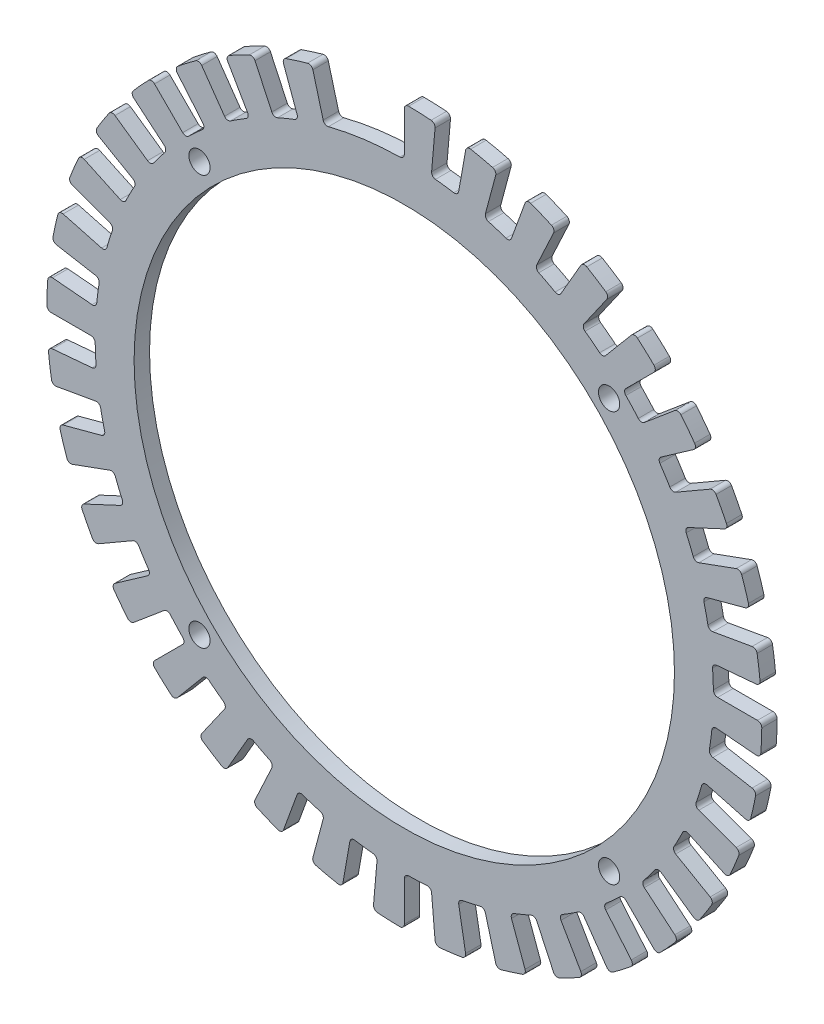
from build123d import *

# Parameters (mm, degrees)
SKETCH1_R           = 62.5
SKETCH1_R_2         = 2.4585
BOSS_EXTRUDE1_DEPTH = 3.571875


with BuildPart() as part:
    # Sketch1 → Boss-Extrude1 (new body)
    with BuildSketch(Plane.XY):
        with BuildLine():
            Line((7.120090774, 81.383009943), (6.318190247, 72.217244977))
            ThreePointArc((6.318190247, 72.217244977), (6.543925597, 71.492600102), (7.213496876, 71.135191451))
            ThreePointArc((7.213496876, 71.135191451), (9.332622744, 70.888307588), (11.443439394, 70.578308954))
            ThreePointArc((11.443439394, 70.578308954), (12.182699751, 70.750241401), (12.58829525, 71.391769993))
            Line((12.58829525, 71.391769993), (14.185993357, 80.45276622))
            ThreePointArc((14.185993357, 80.45276622), (14.60224868, 81.101765071), (15.35649023, 81.261726586))
            ThreePointArc((15.35649023, 81.261726586), (17.899556073, 80.739679789), (20.424982959, 80.138068801))
            ThreePointArc((20.424982959, 80.138068801), (21.040955292, 79.674338181), (21.143931966, 78.910228368))
            Line((21.143931966, 78.910228368), (18.762595726, 70.022960532))
            ThreePointArc((18.762595726, 70.022960532), (18.859068387, 69.270126109), (19.456404014, 68.801877466))
            ThreePointArc((19.456404014, 68.801877466), (21.500464665, 68.190761978), (23.525382569, 67.518933456))
            ThreePointArc((23.525382569, 67.518933456), (24.283267656, 67.559882649), (24.794101519, 68.12123406))
            Line((24.794101519, 68.12123406), (27.940952485, 76.76713603))
            ThreePointArc((27.940952485, 76.76713603), (28.463581422, 77.333993152), (29.234141374, 77.360551822))
            ThreePointArc((29.234141374, 77.360551822), (31.647919857, 76.404837339), (34.030511182, 75.373830397))
            ThreePointArc((34.030511182, 75.373830397), (34.556599534, 74.810182414), (34.525325484, 74.039799434))
            Line((34.525325484, 74.039799434), (30.636909229, 65.701063864))
            ThreePointArc((30.636909229, 65.701063864), (30.601187928, 64.942914386), (31.108138161, 64.378053249))
            ThreePointArc((31.108138161, 64.378053249), (33.015025846, 63.421274572), (34.892518899, 62.40802933))
            ThreePointArc((34.892518899, 62.40802933), (35.646000762, 62.316751049), (36.24655156, 62.780868901))
            Line((36.24655156, 62.780868901), (40.84693991, 70.748975258))
            ThreePointArc((40.84693991, 70.748975258), (41.460062645, 71.216466984), (42.223527925, 71.108815836))
            ThreePointArc((42.223527925, 71.108815836), (44.43467761, 69.748472569), (46.602039543, 68.319396297))
            ThreePointArc((46.602039543, 68.319396297), (47.022258986, 67.67295711), (46.857684459, 66.91970866))
            Line((46.857684459, 66.91970866), (41.580335748, 59.382873618))
            ThreePointArc((41.580335748, 59.382873618), (41.413505858, 58.642445073), (41.814667271, 57.998134462))
            ThreePointArc((41.814667271, 57.998134462), (43.526442174, 56.724763831), (45.199463699, 55.400888814))
            ThreePointArc((45.199463699, 55.400888814), (45.925648172, 55.180156502), (46.597668473, 55.53293881))
            Line((46.597668473, 55.53293881), (52.511813735, 62.581142673))
            ThreePointArc((52.511813735, 62.581142673), (53.196800845, 62.935064503), (53.929973946, 62.696474464))
            ThreePointArc((53.929973946, 62.696474464), (55.87131017, 60.972835754), (57.757588515, 59.189111912))
            ThreePointArc((57.757588515, 59.189111912), (58.059170893, 58.479523249), (57.766296402, 57.766296402))
            Line((57.766296402, 57.766296402), (51.260364806, 51.260364806))
            ThreePointArc((51.260364806, 51.260364806), (50.967495369, 50.56015474), (51.250678875, 49.855971707))
            ThreePointArc((51.250678875, 49.855971707), (52.715329582, 48.304699845), (54.133045666, 46.710420325))
            ThreePointArc((54.133045666, 46.710420325), (54.809868002, 46.366940822), (55.53293881, 46.597668473))
            Line((55.53293881, 46.597668473), (62.581142673, 52.511813735))
            ThreePointArc((62.581142673, 52.511813735), (63.31718117, 52.741411935), (63.997784998, 52.379132441))
            ThreePointArc((63.997784998, 52.379132441), (65.610321242, 50.344570179), (67.158202386, 48.260396313))
            ThreePointArc((67.158202386, 48.260396313), (67.331984272, 47.509218665), (66.91970866, 46.857684459))
            Line((66.91970866, 46.857684459), (59.382873618, 41.580335748))
            ThreePointArc((59.382873618, 41.580335748), (58.972863325, 40.94161969), (59.129464536, 40.19896048))
            ThreePointArc((59.129464536, 40.19896048), (60.302488376, 38.416921997), (61.421822434, 36.600679351))
            ThreePointArc((61.421822434, 36.600679351), (62.028717727, 36.144889108), (62.780868901, 36.24655156))
            Line((62.780868901, 36.24655156), (70.748975258, 40.84693991))
            ThreePointArc((70.748975258, 40.84693991), (71.513700985, 40.945238253), (72.121055738, 40.470276985))
            ThreePointArc((72.121055738, 40.470276985), (73.355795904, 38.186610315), (74.518248261, 35.865312993))
            ThreePointArc((74.518248261, 35.865312993), (74.55894938, 35.095370514), (74.039799434, 34.525325484))
            Line((74.039799434, 34.525325484), (65.701063864, 30.636909229))
            ThreePointArc((65.701063864, 30.636909229), (65.186370669, 30.079094244), (65.211631338, 29.320524181))
            ThreePointArc((65.211631338, 29.320524181), (66.057386575, 27.361865414), (66.844328207, 25.378845255))
            ThreePointArc((66.844328207, 25.378845255), (67.362856253, 24.824593229), (68.12123406, 24.794101519))
            Line((68.12123406, 24.794101519), (76.76713603, 27.940952485))
            ThreePointArc((76.76713603, 27.940952485), (77.537313183, 27.904964226), (78.052964694, 27.331752641))
            ThreePointArc((78.052964694, 27.331752641), (78.872391827, 24.868369619), (79.614094871, 22.380480286))
            ThreePointArc((79.614094871, 22.380480286), (79.52047854, 21.615167288), (78.910228368, 21.143931966))
            Line((78.910228368, 21.143931966), (70.022960532, 18.762595726))
            ThreePointArc((70.022960532, 18.762595726), (69.419223127, 18.30263074), (69.312375721, 17.551198591))
            ThreePointArc((69.312375721, 17.551198591), (69.805164509, 15.475432397), (70.235802893, 13.385887789))
            ThreePointArc((70.235802893, 13.385887789), (70.650208479, 12.750014647), (71.391769993, 12.58829525))
            Line((71.391769993, 12.58829525), (80.45276622, 14.185993357))
            ThreePointArc((80.45276622, 14.185993357), (81.204993357, 14.016811982), (81.613273815, 13.362766823))
            ThreePointArc((81.613273815, 13.362766823), (81.992490036, 10.794516097), (82.290907495, 8.215628011))
            ThreePointArc((82.290907495, 8.215628011), (82.065818199, 7.478198142), (81.383009943, 7.120090774))
            Line((81.383009943, 7.120090774), (72.217244977, 6.318190247))
            ThreePointArc((72.217244977, 6.318190247), (71.542807618, 5.970051062), (71.30709864, 5.248588713))
            ThreePointArc((71.30709864, 5.248588713), (71.431947843, 3.118786197), (71.49319825, 0.986206897))
            ThreePointArc((71.49319825, 0.986206897), (71.79088987, 0.288033321), (72.49310312, 0))
            Line((72.49310312, 0), (81.69387982, 0))
            ThreePointArc((81.69387982, 0), (82.405300898, -0.297234001), (82.693804909, -1.012239902))
            ThreePointArc((82.693804909, -1.012239902), (82.621287925, -3.607323335), (82.467352536, -6.198851964))
            ThreePointArc((82.467352536, -6.198851964), (82.1176295, -6.88599227), (81.383009943, -7.120090774))
            Line((81.383009943, -7.120090774), (72.217244977, -6.318190247))
            ThreePointArc((72.217244977, -6.318190247), (71.492600102, -6.543925597), (71.135191451, -7.213496876))
            ThreePointArc((71.135191451, -7.213496876), (70.888307588, -9.332622744), (70.578308954, -11.443439394))
            ThreePointArc((70.578308954, -11.443439394), (70.750241401, -12.182699751), (71.391769993, -12.58829525))
            Line((71.391769993, -12.58829525), (80.45276622, -14.185993357))
            ThreePointArc((80.45276622, -14.185993357), (81.101765071, -14.60224868), (81.261726586, -15.35649023))
            ThreePointArc((81.261726586, -15.35649023), (80.739679789, -17.899556073), (80.138068801, -20.424982959))
            ThreePointArc((80.138068801, -20.424982959), (79.674338181, -21.040955292), (78.910228368, -21.143931966))
            Line((78.910228368, -21.143931966), (70.022960532, -18.762595726))
            ThreePointArc((70.022960532, -18.762595726), (69.270126109, -18.859068387), (68.801877466, -19.456404014))
            ThreePointArc((68.801877466, -19.456404014), (68.190761979, -21.500464665), (67.518933456, -23.525382569))
            ThreePointArc((67.518933456, -23.525382569), (67.559882649, -24.283267656), (68.12123406, -24.794101519))
            Line((68.12123406, -24.794101519), (76.76713603, -27.940952485))
            ThreePointArc((76.76713603, -27.940952485), (77.333993152, -28.463581422), (77.360551822, -29.234141374))
            ThreePointArc((77.360551822, -29.234141374), (76.404837339, -31.647919857), (75.373830397, -34.030511182))
            ThreePointArc((75.373830397, -34.030511182), (74.810182414, -34.556599534), (74.039799434, -34.525325484))
            Line((74.039799434, -34.525325484), (65.701063864, -30.636909229))
            ThreePointArc((65.701063864, -30.636909229), (64.942914386, -30.601187928), (64.378053249, -31.10813816))
            ThreePointArc((64.378053249, -31.10813816), (63.421274572, -33.015025846), (62.40802933, -34.892518899))
            ThreePointArc((62.40802933, -34.892518899), (62.316751049, -35.646000762), (62.780868901, -36.24655156))
            Line((62.780868901, -36.24655156), (70.748975258, -40.84693991))
            ThreePointArc((70.748975258, -40.84693991), (71.216466984, -41.460062645), (71.108815836, -42.223527925))
            ThreePointArc((71.108815836, -42.223527925), (69.748472569, -44.43467761), (68.319396297, -46.602039543))
            ThreePointArc((68.319396297, -46.602039543), (67.67295711, -47.022258986), (66.91970866, -46.857684459))
            Line((66.91970866, -46.857684459), (59.382873618, -41.580335748))
            ThreePointArc((59.382873618, -41.580335748), (58.642445073, -41.413505858), (57.998134462, -41.814667271))
            ThreePointArc((57.998134462, -41.814667271), (56.724763831, -43.526442174), (55.400888814, -45.199463699))
            ThreePointArc((55.400888814, -45.199463699), (55.180156502, -45.925648172), (55.53293881, -46.597668473))
            Line((55.53293881, -46.597668473), (62.581142673, -52.511813735))
            ThreePointArc((62.581142673, -52.511813735), (62.935064503, -53.196800845), (62.696474464, -53.929973946))
            ThreePointArc((62.696474464, -53.929973946), (60.972835754, -55.87131017), (59.189111912, -57.757588515))
            ThreePointArc((59.189111912, -57.757588515), (58.479523249, -58.059170893), (57.766296402, -57.766296402))
            Line((57.766296402, -57.766296402), (51.260364806, -51.260364806))
            ThreePointArc((51.260364806, -51.260364806), (50.56015474, -50.967495369), (49.855971707, -51.250678875))
            ThreePointArc((49.855971707, -51.250678875), (48.304699845, -52.715329582), (46.710420325, -54.133045666))
            ThreePointArc((46.710420325, -54.133045666), (46.366940822, -54.809868002), (46.597668473, -55.53293881))
            Line((46.597668473, -55.53293881), (52.511813735, -62.581142673))
            ThreePointArc((52.511813735, -62.581142673), (52.741411935, -63.31718117), (52.379132441, -63.997784998))
            ThreePointArc((52.379132441, -63.997784998), (50.344570179, -65.610321242), (48.260396313, -67.158202386))
            ThreePointArc((48.260396313, -67.158202386), (47.509218665, -67.331984272), (46.857684459, -66.91970866))
            Line((46.857684459, -66.91970866), (41.580335748, -59.382873618))
            ThreePointArc((41.580335748, -59.382873618), (40.94161969, -58.972863325), (40.19896048, -59.129464536))
            ThreePointArc((40.19896048, -59.129464536), (38.416921997, -60.302488376), (36.600679351, -61.421822434))
            ThreePointArc((36.600679351, -61.421822434), (36.144889108, -62.028717727), (36.24655156, -62.780868901))
            Line((36.24655156, -62.780868901), (40.84693991, -70.748975258))
            ThreePointArc((40.84693991, -70.748975258), (40.945238253, -71.513700985), (40.470276985, -72.121055738))
            ThreePointArc((40.470276985, -72.121055738), (38.186610315, -73.355795904), (35.865312993, -74.518248261))
            ThreePointArc((35.865312993, -74.518248261), (35.095370514, -74.55894938), (34.525325484, -74.039799434))
            Line((34.525325484, -74.039799434), (30.636909229, -65.701063864))
            ThreePointArc((30.636909229, -65.701063864), (30.079094244, -65.186370669), (29.320524181, -65.211631338))
            ThreePointArc((29.320524181, -65.211631338), (27.361865414, -66.057386575), (25.378845255, -66.844328207))
            ThreePointArc((25.378845255, -66.844328207), (24.824593229, -67.362856253), (24.794101519, -68.12123406))
            Line((24.794101519, -68.12123406), (27.940952485, -76.76713603))
            ThreePointArc((27.940952485, -76.76713603), (27.904964226, -77.537313183), (27.331752641, -78.052964694))
            ThreePointArc((27.331752641, -78.052964694), (24.868369619, -78.872391827), (22.380480286, -79.614094871))
            ThreePointArc((22.380480286, -79.614094871), (21.615167288, -79.52047854), (21.143931966, -78.910228368))
            Line((21.143931966, -78.910228368), (18.762595726, -70.022960532))
            ThreePointArc((18.762595726, -70.022960532), (18.30263074, -69.419223127), (17.551198591, -69.312375721))
            ThreePointArc((17.551198591, -69.312375721), (15.475432397, -69.805164509), (13.385887789, -70.235802893))
            ThreePointArc((13.385887789, -70.235802893), (12.750014647, -70.650208479), (12.58829525, -71.391769993))
            Line((12.58829525, -71.391769993), (14.185993357, -80.45276622))
            ThreePointArc((14.185993357, -80.45276622), (14.016811982, -81.204993357), (13.362766823, -81.613273815))
            ThreePointArc((13.362766823, -81.613273815), (10.794516097, -81.992490036), (8.215628011, -82.290907495))
            ThreePointArc((8.215628011, -82.290907495), (7.478198142, -82.065818199), (7.120090774, -81.383009943))
            Line((7.120090774, -81.383009943), (6.318190247, -72.217244977))
            ThreePointArc((6.318190247, -72.217244977), (5.970051062, -71.542807618), (5.248588713, -71.30709864))
            ThreePointArc((5.248588713, -71.30709864), (3.118786197, -71.431947843), (0.986206897, -71.49319825))
            ThreePointArc((0.986206897, -71.49319825), (0.288033321, -71.79088987), (0, -72.49310312))
            Line((0, -72.49310312), (0, -81.69387982))
            ThreePointArc((0, -81.69387982), (-0.297234001, -82.405300898), (-1.012239902, -82.693804909))
            ThreePointArc((-1.012239902, -82.693804909), (-3.607323335, -82.621287925), (-6.198851964, -82.467352536))
            ThreePointArc((-6.198851964, -82.467352536), (-6.88599227, -82.1176295), (-7.120090774, -81.383009943))
            Line((-7.120090774, -81.383009943), (-6.318190247, -72.217244977))
            ThreePointArc((-6.318190247, -72.217244977), (-6.543925597, -71.492600102), (-7.213496876, -71.135191451))
            ThreePointArc((-7.213496876, -71.135191451), (-9.332622744, -70.888307588), (-11.443439394, -70.578308954))
            ThreePointArc((-11.443439394, -70.578308954), (-12.182699751, -70.750241401), (-12.58829525, -71.391769993))
            Line((-12.58829525, -71.391769993), (-14.185993357, -80.45276622))
            ThreePointArc((-14.185993357, -80.45276622), (-14.60224868, -81.101765071), (-15.35649023, -81.261726586))
            ThreePointArc((-15.35649023, -81.261726586), (-17.899556073, -80.739679789), (-20.424982959, -80.138068801))
            ThreePointArc((-20.424982959, -80.138068801), (-21.040955292, -79.674338181), (-21.143931966, -78.910228368))
            Line((-21.143931966, -78.910228368), (-18.762595726, -70.022960532))
            ThreePointArc((-18.762595726, -70.022960532), (-18.859068387, -69.270126109), (-19.456404014, -68.801877466))
            ThreePointArc((-19.456404014, -68.801877466), (-21.500464665, -68.190761979), (-23.525382569, -67.518933456))
            ThreePointArc((-23.525382569, -67.518933456), (-24.283267656, -67.559882649), (-24.794101519, -68.12123406))
            Line((-24.794101519, -68.12123406), (-27.940952485, -76.76713603))
            ThreePointArc((-27.940952485, -76.76713603), (-28.463581422, -77.333993152), (-29.234141374, -77.360551822))
            ThreePointArc((-29.234141374, -77.360551822), (-31.647919857, -76.404837339), (-34.030511182, -75.373830397))
            ThreePointArc((-34.030511182, -75.373830397), (-34.556599534, -74.810182414), (-34.525325484, -74.039799434))
            Line((-34.525325484, -74.039799434), (-30.636909229, -65.701063864))
            ThreePointArc((-30.636909229, -65.701063864), (-30.601187928, -64.942914386), (-31.10813816, -64.378053249))
            ThreePointArc((-31.10813816, -64.378053249), (-33.015025846, -63.421274572), (-34.892518899, -62.40802933))
            ThreePointArc((-34.892518899, -62.40802933), (-35.646000762, -62.316751049), (-36.24655156, -62.780868901))
            Line((-36.24655156, -62.780868901), (-40.84693991, -70.748975258))
            ThreePointArc((-40.84693991, -70.748975258), (-41.460062645, -71.216466984), (-42.223527925, -71.108815836))
            ThreePointArc((-42.223527925, -71.108815836), (-44.43467761, -69.748472569), (-46.602039543, -68.319396297))
            ThreePointArc((-46.602039543, -68.319396297), (-47.022258986, -67.67295711), (-46.857684459, -66.91970866))
            Line((-46.857684459, -66.91970866), (-41.580335748, -59.382873618))
            ThreePointArc((-41.580335748, -59.382873618), (-41.413505858, -58.642445073), (-41.814667271, -57.998134462))
            ThreePointArc((-41.814667271, -57.998134462), (-43.526442174, -56.724763831), (-45.199463699, -55.400888814))
            ThreePointArc((-45.199463699, -55.400888814), (-45.925648172, -55.180156502), (-46.597668473, -55.53293881))
            Line((-46.597668473, -55.53293881), (-52.511813735, -62.581142673))
            ThreePointArc((-52.511813735, -62.581142673), (-53.196800845, -62.935064504), (-53.929973946, -62.696474464))
            ThreePointArc((-53.929973946, -62.696474464), (-55.87131017, -60.972835754), (-57.757588515, -59.189111912))
            ThreePointArc((-57.757588515, -59.189111912), (-58.059170893, -58.479523249), (-57.766296402, -57.766296402))
            Line((-57.766296402, -57.766296402), (-51.260364806, -51.260364806))
            ThreePointArc((-51.260364806, -51.260364806), (-50.967495369, -50.56015474), (-51.250678875, -49.855971707))
            ThreePointArc((-51.250678875, -49.855971707), (-52.715329582, -48.304699845), (-54.133045666, -46.710420325))
            ThreePointArc((-54.133045666, -46.710420325), (-54.809868002, -46.366940822), (-55.53293881, -46.597668473))
            Line((-55.53293881, -46.597668473), (-62.581142673, -52.511813735))
            ThreePointArc((-62.581142673, -52.511813735), (-63.31718117, -52.741411935), (-63.997784998, -52.379132441))
            ThreePointArc((-63.997784998, -52.379132441), (-65.610321242, -50.344570179), (-67.158202386, -48.260396313))
            ThreePointArc((-67.158202386, -48.260396313), (-67.331984272, -47.509218665), (-66.91970866, -46.857684459))
            Line((-66.91970866, -46.857684459), (-59.382873618, -41.580335748))
            ThreePointArc((-59.382873618, -41.580335748), (-58.972863325, -40.94161969), (-59.129464536, -40.19896048))
            ThreePointArc((-59.129464536, -40.19896048), (-60.302488376, -38.416921997), (-61.421822434, -36.600679351))
            ThreePointArc((-61.421822434, -36.600679351), (-62.028717727, -36.144889108), (-62.780868901, -36.24655156))
            Line((-62.780868901, -36.24655156), (-70.748975258, -40.84693991))
            ThreePointArc((-70.748975258, -40.84693991), (-71.513700985, -40.945238253), (-72.121055738, -40.470276985))
            ThreePointArc((-72.121055738, -40.470276985), (-73.355795904, -38.186610315), (-74.518248261, -35.865312993))
            ThreePointArc((-74.518248261, -35.865312993), (-74.55894938, -35.095370514), (-74.039799434, -34.525325484))
            Line((-74.039799434, -34.525325484), (-65.701063864, -30.636909229))
            ThreePointArc((-65.701063864, -30.636909229), (-65.186370669, -30.079094244), (-65.211631338, -29.320524181))
            ThreePointArc((-65.211631338, -29.320524181), (-66.057386575, -27.361865414), (-66.844328207, -25.378845255))
            ThreePointArc((-66.844328207, -25.378845255), (-67.362856253, -24.824593229), (-68.12123406, -24.794101519))
            Line((-68.12123406, -24.794101519), (-76.76713603, -27.940952485))
            ThreePointArc((-76.76713603, -27.940952485), (-77.537313183, -27.904964226), (-78.052964694, -27.331752641))
            ThreePointArc((-78.052964694, -27.331752641), (-78.872391827, -24.868369619), (-79.614094871, -22.380480286))
            ThreePointArc((-79.614094871, -22.380480286), (-79.52047854, -21.615167288), (-78.910228368, -21.143931966))
            Line((-78.910228368, -21.143931966), (-70.022960532, -18.762595726))
            ThreePointArc((-70.022960532, -18.762595726), (-69.419223127, -18.30263074), (-69.312375721, -17.551198591))
            ThreePointArc((-69.312375721, -17.551198591), (-69.805164509, -15.475432397), (-70.235802893, -13.385887789))
            ThreePointArc((-70.235802893, -13.385887789), (-70.650208479, -12.750014647), (-71.391769993, -12.58829525))
            Line((-71.391769993, -12.58829525), (-80.45276622, -14.185993357))
            ThreePointArc((-80.45276622, -14.185993357), (-81.204993357, -14.016811982), (-81.613273815, -13.362766823))
            ThreePointArc((-81.613273815, -13.362766823), (-81.992490036, -10.794516097), (-82.290907495, -8.215628011))
            ThreePointArc((-82.290907495, -8.215628011), (-82.065818199, -7.478198142), (-81.383009943, -7.120090774))
            Line((-81.383009943, -7.120090774), (-72.217244977, -6.318190247))
            ThreePointArc((-72.217244977, -6.318190247), (-71.542807618, -5.970051062), (-71.30709864, -5.248588713))
            ThreePointArc((-71.30709864, -5.248588713), (-71.431947843, -3.118786197), (-71.49319825, -0.986206897))
            ThreePointArc((-71.49319825, -0.986206897), (-71.79088987, -0.288033321), (-72.49310312, 0))
            Line((-72.49310312, 0), (-81.69387982, 0))
            ThreePointArc((-81.69387982, 0), (-82.405300898, 0.297234001), (-82.693804909, 1.012239902))
            ThreePointArc((-82.693804909, 1.012239902), (-82.621287925, 3.607323335), (-82.467352536, 6.198851964))
            ThreePointArc((-82.467352536, 6.198851964), (-82.1176295, 6.88599227), (-81.383009943, 7.120090774))
            Line((-81.383009943, 7.120090774), (-72.217244977, 6.318190247))
            ThreePointArc((-72.217244977, 6.318190247), (-71.492600102, 6.543925597), (-71.135191451, 7.213496876))
            ThreePointArc((-71.135191451, 7.213496876), (-70.888307588, 9.332622744), (-70.578308954, 11.443439394))
            ThreePointArc((-70.578308954, 11.443439394), (-70.750241401, 12.182699751), (-71.391769993, 12.58829525))
            Line((-71.391769993, 12.58829525), (-80.45276622, 14.185993357))
            ThreePointArc((-80.45276622, 14.185993357), (-81.101765071, 14.60224868), (-81.261726586, 15.35649023))
            ThreePointArc((-81.261726586, 15.35649023), (-80.739679789, 17.899556073), (-80.138068801, 20.424982959))
            ThreePointArc((-80.138068801, 20.424982959), (-79.674338181, 21.040955292), (-78.910228368, 21.143931966))
            Line((-78.910228368, 21.143931966), (-70.022960532, 18.762595726))
            ThreePointArc((-70.022960532, 18.762595726), (-69.270126109, 18.859068387), (-68.801877466, 19.456404014))
            ThreePointArc((-68.801877466, 19.456404014), (-68.190761979, 21.500464665), (-67.518933456, 23.525382569))
            ThreePointArc((-67.518933456, 23.525382569), (-67.559882649, 24.283267656), (-68.12123406, 24.794101519))
            Line((-68.12123406, 24.794101519), (-76.76713603, 27.940952485))
            ThreePointArc((-76.76713603, 27.940952485), (-77.333993152, 28.463581422), (-77.360551822, 29.234141374))
            ThreePointArc((-77.360551822, 29.234141374), (-76.404837339, 31.647919857), (-75.373830397, 34.030511182))
            ThreePointArc((-75.373830397, 34.030511182), (-74.810182414, 34.556599534), (-74.039799434, 34.525325484))
            Line((-74.039799434, 34.525325484), (-65.701063864, 30.636909229))
            ThreePointArc((-65.701063864, 30.636909229), (-64.942914386, 30.601187928), (-64.378053249, 31.10813816))
            ThreePointArc((-64.378053249, 31.10813816), (-63.421274572, 33.015025846), (-62.40802933, 34.892518899))
            ThreePointArc((-62.40802933, 34.892518899), (-62.316751049, 35.646000762), (-62.780868901, 36.24655156))
            Line((-62.780868901, 36.24655156), (-70.748975258, 40.84693991))
            ThreePointArc((-70.748975258, 40.84693991), (-71.216466984, 41.460062645), (-71.108815836, 42.223527925))
            ThreePointArc((-71.108815836, 42.223527925), (-69.748472569, 44.43467761), (-68.319396297, 46.602039543))
            ThreePointArc((-68.319396297, 46.602039543), (-67.67295711, 47.022258986), (-66.91970866, 46.857684459))
            Line((-66.91970866, 46.857684459), (-59.382873618, 41.580335748))
            ThreePointArc((-59.382873618, 41.580335748), (-58.642445073, 41.413505858), (-57.998134462, 41.814667271))
            ThreePointArc((-57.998134462, 41.814667271), (-56.724763831, 43.526442174), (-55.400888814, 45.199463699))
            ThreePointArc((-55.400888814, 45.199463699), (-55.180156502, 45.925648172), (-55.53293881, 46.597668473))
            Line((-55.53293881, 46.597668473), (-62.581142673, 52.511813735))
            ThreePointArc((-62.581142673, 52.511813735), (-62.935064504, 53.196800845), (-62.696474464, 53.929973946))
            ThreePointArc((-62.696474464, 53.929973946), (-60.972835754, 55.87131017), (-59.189111912, 57.757588515))
            ThreePointArc((-59.189111912, 57.757588515), (-58.479523249, 58.059170893), (-57.766296402, 57.766296402))
            Line((-57.766296402, 57.766296402), (-51.260364806, 51.260364806))
            ThreePointArc((-51.260364806, 51.260364806), (-50.56015474, 50.967495369), (-49.855971707, 51.250678875))
            ThreePointArc((-49.855971707, 51.250678875), (-48.304699845, 52.715329582), (-46.710420325, 54.133045666))
            ThreePointArc((-46.710420325, 54.133045666), (-46.366940822, 54.809868002), (-46.597668473, 55.53293881))
            Line((-46.597668473, 55.53293881), (-52.511813735, 62.581142673))
            ThreePointArc((-52.511813735, 62.581142673), (-52.741411935, 63.31718117), (-52.379132441, 63.997784998))
            ThreePointArc((-52.379132441, 63.997784998), (-50.344570179, 65.610321242), (-48.260396313, 67.158202386))
            ThreePointArc((-48.260396313, 67.158202386), (-47.509218665, 67.331984272), (-46.857684459, 66.91970866))
            Line((-46.857684459, 66.91970866), (-41.580335748, 59.382873618))
            ThreePointArc((-41.580335748, 59.382873618), (-40.94161969, 58.972863325), (-40.19896048, 59.129464536))
            ThreePointArc((-40.19896048, 59.129464536), (-38.416921997, 60.302488376), (-36.600679351, 61.421822434))
            ThreePointArc((-36.600679351, 61.421822434), (-36.144889108, 62.028717727), (-36.24655156, 62.780868901))
            Line((-36.24655156, 62.780868901), (-40.84693991, 70.748975258))
            ThreePointArc((-40.84693991, 70.748975258), (-40.945238253, 71.513700985), (-40.470276985, 72.121055738))
            ThreePointArc((-40.470276985, 72.121055738), (-38.186610315, 73.355795904), (-35.865312993, 74.518248261))
            ThreePointArc((-35.865312993, 74.518248261), (-35.095370514, 74.55894938), (-34.525325484, 74.039799434))
            Line((-34.525325484, 74.039799434), (-30.636909229, 65.701063864))
            ThreePointArc((-30.636909229, 65.701063864), (-30.079094244, 65.186370669), (-29.320524181, 65.211631338))
            ThreePointArc((-29.320524181, 65.211631338), (-27.361865414, 66.057386575), (-25.378845255, 66.844328207))
            ThreePointArc((-25.378845255, 66.844328207), (-24.824593229, 67.362856253), (-24.794101519, 68.12123406))
            Line((-24.794101519, 68.12123406), (-27.940952485, 76.76713603))
            ThreePointArc((-27.940952485, 76.76713603), (-27.904964226, 77.537313183), (-27.331752641, 78.052964694))
            ThreePointArc((-27.331752641, 78.052964694), (-24.868369619, 78.872391827), (-22.380480286, 79.614094871))
            ThreePointArc((-22.380480286, 79.614094871), (-21.615167288, 79.52047854), (-21.143931966, 78.910228368))
            Line((-21.143931966, 78.910228368), (-18.762595726, 70.022960532))
            ThreePointArc((-18.762595726, 70.022960532), (-18.30263074, 69.419223127), (-17.551198591, 69.312375721))
            ThreePointArc((-17.551198591, 69.312375721), (-15.475432397, 69.805164509), (-13.385887789, 70.235802893))
            ThreePointArc((-13.385887789, 70.235802893), (-7.233029315, 71.133208046), (-1.025468774, 71.492645872))
            Line((-1.025468774, 71.492645872), (-0.986206897, 71.49319825))
            ThreePointArc((-0.986206897, 71.49319825), (-0.288033321, 71.79088987), (0, 72.49310312))
            Line((0, 72.49310312), (0, 81.69387982))
            ThreePointArc((0, 81.69387982), (0.297234001, 82.405300898), (1.012239902, 82.693804909))
            ThreePointArc((1.012239902, 82.693804909), (3.607323335, 82.621287925), (6.198851964, 82.467352536))
            ThreePointArc((6.198851964, 82.467352536), (6.88599227, 82.1176295), (7.120090774, 81.383009943))
        make_face()
        Circle(SKETCH1_R, mode=Mode.SUBTRACT)
        with Locations((47.376154339, 47.376154339)):
            Circle(SKETCH1_R_2, mode=Mode.SUBTRACT)
        with Locations((-47.376154339, -47.376154339)):
            Circle(SKETCH1_R_2, mode=Mode.SUBTRACT)
        with Locations((47.376154339, -47.376154339)):
            Circle(SKETCH1_R_2, mode=Mode.SUBTRACT)
        with Locations((-47.376154339, 47.376154339)):
            Circle(SKETCH1_R_2, mode=Mode.SUBTRACT)
    extrude(amount=BOSS_EXTRUDE1_DEPTH)


solid = part.part
